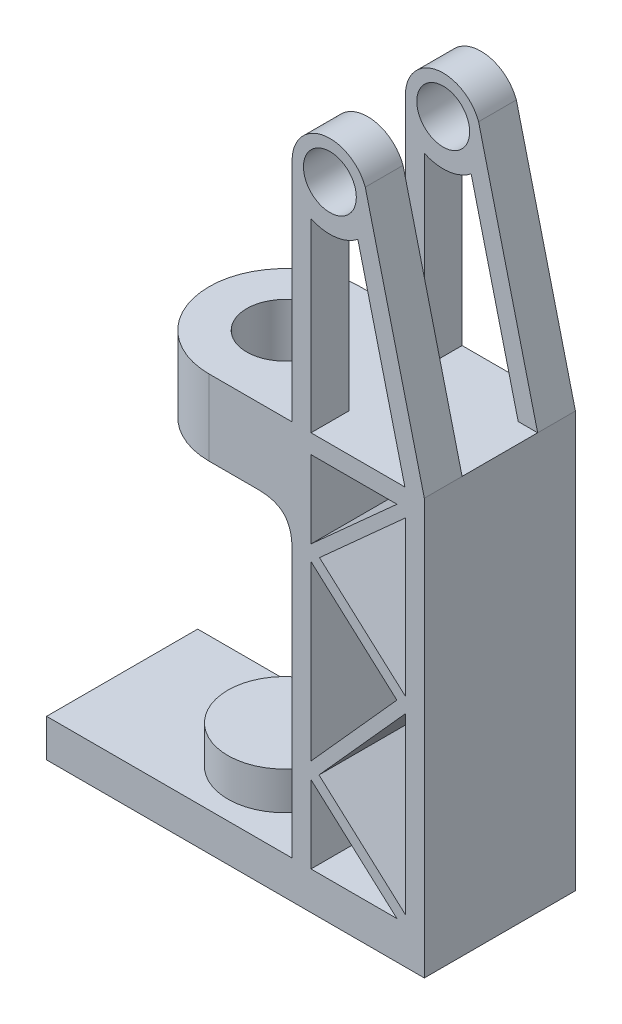
from build123d import *

# Parameters (mm, degrees)
BOSS_EXTRUDE1_DEPTH      = 20
BOSS_EXTRUDE1_DEPTH_BACK = 20
SKETCH1_R                = 7
SKETCH2_W                = 100
SKETCH2_H                = 10
BOSS_EXTRUDE2_DEPTH      = 40
FILLET1_R                = 20
SKETCH3_R                = 10
CUT_EXTRUDE1_DEPTH       = 40
FILLET2_SIZE             = 10
SKETCH4_W                = 20
SKETCH4_H                = 70
CUT_EXTRUDE2_DEPTH       = 50
SKETCH5_R                = 15
BOSS_EXTRUDE3_DEPTH      = 10
CUT_EXTRUDE4_DEPTH       = 10
CUT_EXTRUDE4_DEPTH_BACK  = 56


# Some blends are built 0.0001 mm under size
with BuildPart() as part:
    # Sketch1 → Boss-Extrude1 (new, two sides: drawn at the far end of the back side and taken through both)
    with BuildSketch(Plane.XY.offset(-BOSS_EXTRUDE1_DEPTH_BACK)):
        with BuildLine():
            Line((0, 0), (0, 60))
            ThreePointArc((0, 60), (8.220336618, 69.840365758), (19.36655965, 63.502507721))
            Line((19.36655965, 63.502507721), (35, 0))
            Line((35, 0), (35, -110))
            Line((35, -110), (0, -110))
            Line((0, -110), (0, -90))
            Line((0, -90), (0, -20))
            Line((0, -20), (-42, -20))
            Line((-42, -20), (-42, 0))
            Line((-42, 0), (0, 0))
        make_face()
        with Locations((10, 60)):
            Circle(SKETCH1_R, mode=Mode.SUBTRACT)
    extrude(amount=BOSS_EXTRUDE1_DEPTH + BOSS_EXTRUDE1_DEPTH_BACK)

    # Sketch2 → Boss-Extrude2 (add)
    with BuildSketch(Plane.XY.offset(20)):
        with Locations((-15, -105)):
            Rectangle(SKETCH2_W, SKETCH2_H)
    extrude(amount=-BOSS_EXTRUDE2_DEPTH)

    # Fillet1
    fillet1_edges = [part.edges().sort_by_distance(p)[0] for p in [
        (-42, -10, 20),
        (-42, -10, -20),
    ]]
    fillet(fillet1_edges, radius=FILLET1_R - 0.0001)  # a hair under: the kernel refuses the full size

    # Sketch3 → Cut-Extrude1 (cut)
    with BuildSketch(Plane(origin=(0, 0, 0), x_dir=(1, 0, 0), z_dir=(0, 1, 0))):
        with Locations(Location((-22, 0, 0), (0, 0, 270))):
            Circle(SKETCH3_R)
    extrude(amount=-CUT_EXTRUDE1_DEPTH, mode=Mode.SUBTRACT)

    # Fillet2
    # a fillet whose section is not a circle: 10 mm, written as the material it adds along each edge
    with BuildSketch(Plane(origin=(0, -20, 20), x_dir=(-1, 0, 0), z_dir=(0, 0, -1))) as fillet2_piece_1:
        with BuildLine():
            add(Edge.make_bspline([(FILLET2_SIZE, 0), (FILLET2_SIZE * 0.831801948466, 0), (FILLET2_SIZE * 0.663603896932, 0), (FILLET2_SIZE * 0.292893218813, -FILLET2_SIZE * 0.0716919198361), (FILLET2_SIZE * 0.0716919198361, -FILLET2_SIZE * 0.292893218813), (0, -FILLET2_SIZE * 0.663603896932), (0, -FILLET2_SIZE * 0.831801948466), (0, -FILLET2_SIZE)], knots=[0, 0, 0, 0, 0, 0, 0.5, 0.5, 1, 1, 1, 1, 1, 1], degree=5))
            Line((0, -FILLET2_SIZE), (-FILLET2_SIZE * 0.02, -FILLET2_SIZE))
            Line((-FILLET2_SIZE * 0.02, -FILLET2_SIZE), (-FILLET2_SIZE * 0.02, FILLET2_SIZE * 0.02))
            Line((-FILLET2_SIZE * 0.02, FILLET2_SIZE * 0.02), (FILLET2_SIZE, FILLET2_SIZE * 0.02))
            Line((FILLET2_SIZE, FILLET2_SIZE * 0.02), (FILLET2_SIZE, 0))
        make_face()
    extrude(amount=40)

    # Sketch4 → Cut-Extrude2 (cut)
    with BuildSketch(Plane.ZY):
        with Locations((0, 35)):
            Rectangle(SKETCH4_W, SKETCH4_H)
    extrude(amount=-CUT_EXTRUDE2_DEPTH, mode=Mode.SUBTRACT)

    # Sketch5 → Boss-Extrude3 (add)
    with BuildSketch(Plane(origin=(0, -100, 0), x_dir=(1, 0, 0), z_dir=(0, 1, 0))):
        with Locations(Location((-22, 0, 0), (0, 0, 180))):
            Circle(SKETCH5_R)
    extrude(amount=BOSS_EXTRUDE3_DEPTH)

    # Sketch6 → Cut-Extrude4 (cut, two sides: drawn at the far end of the back side and taken through both)
    with BuildSketch(Plane.XY.offset(20).offset(-CUT_EXTRUDE4_DEPTH_BACK)):
        Polygon((30, -47.923364513), (30, -7.018043607), (7.243954377, -27.498484668), align=None)
        Polygon((27.757729325, -5), (5, -5), (5, -25.481956393), align=None)
        Polygon((27.736463224, -49.922898925), (5, -29.515595427), (5, -30), (5, -75.254357341), align=None)
        Polygon((30, -97.981956393), (30, -51.892301788), (7.116883504, -77.387151546), align=None)
        Polygon((27.757729325, -100), (5, -79.518043607), (5, -100), align=None)
        with BuildLine():
            Line((29.850709662, 0), (17.404345208, 50.556712859))
            ThreePointArc((17.404345208, 50.556712859), (11.407865959, 48.082873105), (5, 49.091287885))
            Line((5, 49.091287885), (5, 0))
            Line((5, 0), (29.850709662, 0))
        make_face()
    extrude(amount=CUT_EXTRUDE4_DEPTH + CUT_EXTRUDE4_DEPTH_BACK, mode=Mode.SUBTRACT)


solid = part.part
